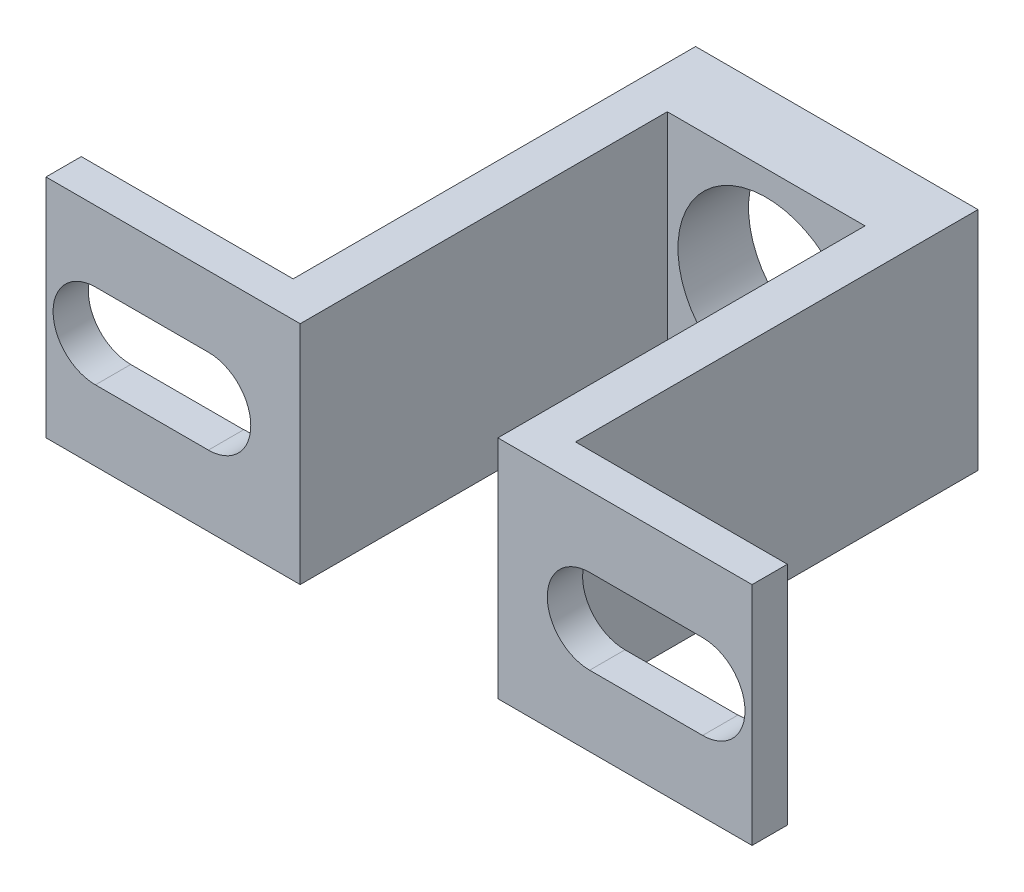
from build123d import *

# Parameters (mm, degrees)
SKETCH1_W           = 20
SKETCH1_H           = 16
SKETCH1_R           = 6.25
BOSS_EXTRUDE1_DEPTH = 5
SKETCH2_W           = 3
SKETCH2_H           = 16
BOSS_EXTRUDE2_DEPTH = 26
SKETCH3_W           = 18
SKETCH3_H           = 16
BOSS_EXTRUDE3_DEPTH = 2.5
CUT_EXTRUDE1_DEPTH  = 39.745967532


with BuildPart() as part:
    # Sketch1 → Boss-Extrude1 (new body)
    with BuildSketch(Plane.XY):
        Rectangle(SKETCH1_W, SKETCH1_H)
        Circle(SKETCH1_R, mode=Mode.SUBTRACT)
    extrude(amount=BOSS_EXTRUDE1_DEPTH)

    # Sketch2 → Boss-Extrude2 (add)
    with BuildSketch(Plane.XY.offset(5)):
        with Locations((-8.5, 0)):
            Rectangle(SKETCH2_W, SKETCH2_H)
        with Locations((8.5, 0)):
            Rectangle(SKETCH2_W, SKETCH2_H)
    extrude(amount=BOSS_EXTRUDE2_DEPTH)

    # Sketch3 → Boss-Extrude3 (add)
    with BuildSketch(Plane.XY.offset(31)):
        with Locations((-16, 0)):
            Rectangle(SKETCH3_W, SKETCH3_H)
        with Locations((16, 0)):
            Rectangle(SKETCH3_W, SKETCH3_H)
    extrude(amount=-BOSS_EXTRUDE3_DEPTH)

    # Sketch4 → Cut-Extrude1 (cut, through all)
    with BuildSketch(Plane(origin=(0, 0, 28.5), x_dir=(-1, 0, 0), z_dir=(0, 0, -1))):
        with BuildLine():
            Line((-21.5, 3), (-13.5, 3))
            ThreePointArc((-13.5, 3), (-10.5, 0), (-13.5, -3))
            Line((-13.5, -3), (-21.5, -3))
            ThreePointArc((-21.5, -3), (-24.5, 0), (-21.5, 3))
        make_face()
        with BuildLine():
            Line((21.5, 3), (13.5, 3))
            ThreePointArc((13.5, 3), (10.5, 0), (13.5, -3))
            Line((13.5, -3), (21.5, -3))
            ThreePointArc((21.5, -3), (24.5, 0), (21.5, 3))
        make_face()
    extrude(amount=-CUT_EXTRUDE1_DEPTH, mode=Mode.SUBTRACT)


solid = part.part
